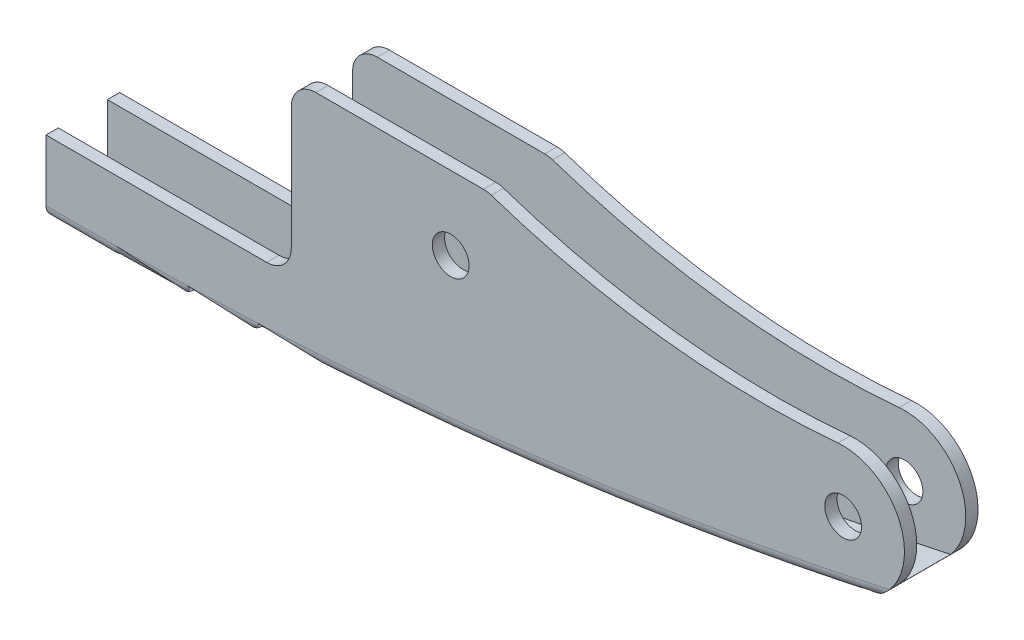
from build123d import *

# Parameters (mm, degrees)
SCHIZZO1_R                   = 0.75
ESTRUSIONE_ESTRUSIONE1_DEPTH = 3
TAGLIO_ESTRUSIONE2_START     = 0.5
TAGLIO_ESTRUSIONE2_OUTLINE_R = 0.75
TAGLIO_ESTRUSIONE2_DEPTH     = 2
RACCORDO1_R                  = 0.5


with BuildPart() as part:
    # Schizzo1 → Estrusione-Estrusione1 (new body)
    with BuildSketch(Plane.XY):
        with BuildLine():
            Line((1.335883711, 7), (-5.5, 7))
            ThreePointArc((-5.5, 7), (-6.207106781, 6.707106781), (-6.5, 6))
            Line((-6.5, 6), (-6.5, 1))
            ThreePointArc((-6.5, 1), (-6.792893219, 0.292893219), (-7.5, 0))
            Line((-7.5, 0), (-16.5, 0))
            Line((-16.5, 0), (-16.5, -3))
            ThreePointArc((-16.5, -3), (0.101782453, -2.23760178), (16.521096634, 0.332719886))
            ThreePointArc((16.521096634, 0.332719886), (18.472600065, 3.146927603), (15.784267214, 5.268482974))
            ThreePointArc((15.784267214, 5.268482974), (8.632526621, 5.382625954), (1.653331613, 6.948275714))
            ThreePointArc((1.653331613, 6.948275714), (1.496700822, 6.986984223), (1.335883711, 7))
        make_face()
        with Locations((0, 4)):
            Circle(SCHIZZO1_R, mode=Mode.SUBTRACT)
        with Locations((16, 2.777808494)):
            Circle(SCHIZZO1_R, mode=Mode.SUBTRACT)
    extrude(amount=ESTRUSIONE_ESTRUSIONE1_DEPTH)

    # Taglio-Estrusione2: read off the stored shape, not the designer's step
    # Taglio-Estrusione2 outline → Taglio-Estrusione2 (cut)
    with BuildSketch(Plane.XY.offset(TAGLIO_ESTRUSIONE2_START)):
        with BuildLine():
            ThreePointArc((-16.5, -2.5), (0.79291183, -1.666252109), (17.878837946, 1.128575953))
            ThreePointArc((17.878837946, 1.128575953), (18.230736925, 3.906441637), (15.784267214, 5.268482974))
            ThreePointArc((15.784267214, 5.268482974), (8.632526621, 5.382625954), (1.653331613, 6.948275714))
            ThreePointArc((1.653331613, 6.948275714), (1.496700822, 6.986984223), (1.335883711, 7))
            Line((1.335883711, 7), (-5.5, 7))
            ThreePointArc((-5.5, 7), (-6.207106781, 6.707106781), (-6.5, 6))
            Line((-6.5, 6), (-6.5, 1))
            ThreePointArc((-6.5, 1), (-6.792893219, 0.292893219), (-7.5, 0))
            Line((-7.5, 0), (-16.5, 0))
            Line((-16.5, 0), (-16.5, -2.5))
        make_face()
        with Locations((0, 4)):
            Circle(TAGLIO_ESTRUSIONE2_OUTLINE_R, mode=Mode.SUBTRACT)
        with Locations((16, 2.777808494)):
            Circle(TAGLIO_ESTRUSIONE2_OUTLINE_R, mode=Mode.SUBTRACT)
    extrude(amount=TAGLIO_ESTRUSIONE2_DEPTH, mode=Mode.SUBTRACT)

    # Raccordo1
    # the kernel refuses this fillet: 0.5 mm, written as the material it takes off along each edge
    with BuildSketch(Plane(origin=(-15.161578714, 148.994107216, 0), x_dir=(-0.017028442214045383, -0.9998550055661886, 0), z_dir=(-0.9998550055661886, 0.017028442214045383, 0))) as raccordo1_piece_1:
        with BuildLine():
            CenterArc((152 - RACCORDO1_R, RACCORDO1_R), RACCORDO1_R, 270, 90)
            Line((152, RACCORDO1_R), (152, 0))
            Line((152, 0), (152 - RACCORDO1_R, 0))
        make_face()
    revolve(axis=Axis((-15.161578714, 148.994107216, 0), (0, 0, 1)), revolution_arc=13.807590381, mode=Mode.SUBTRACT)
    with BuildSketch(Plane(origin=(-15.161578714, 148.994107216, 3), x_dir=(-0.017028442214045383, -0.9998550055661886, 0), z_dir=(-0.9998550055661886, 0.017028442214045383, 0))) as raccordo1_piece_2:
        with BuildLine():
            CenterArc((152 - RACCORDO1_R, -RACCORDO1_R), RACCORDO1_R, 0, 90)
            Line((152 - RACCORDO1_R, 0), (152, 0))
            Line((152, 0), (152, -RACCORDO1_R))
        make_face()
    revolve(axis=Axis((-15.161578714, 148.994107216, 3), (0, 0, 1)), revolution_arc=13.807590381, mode=Mode.SUBTRACT)


solid = part.part
